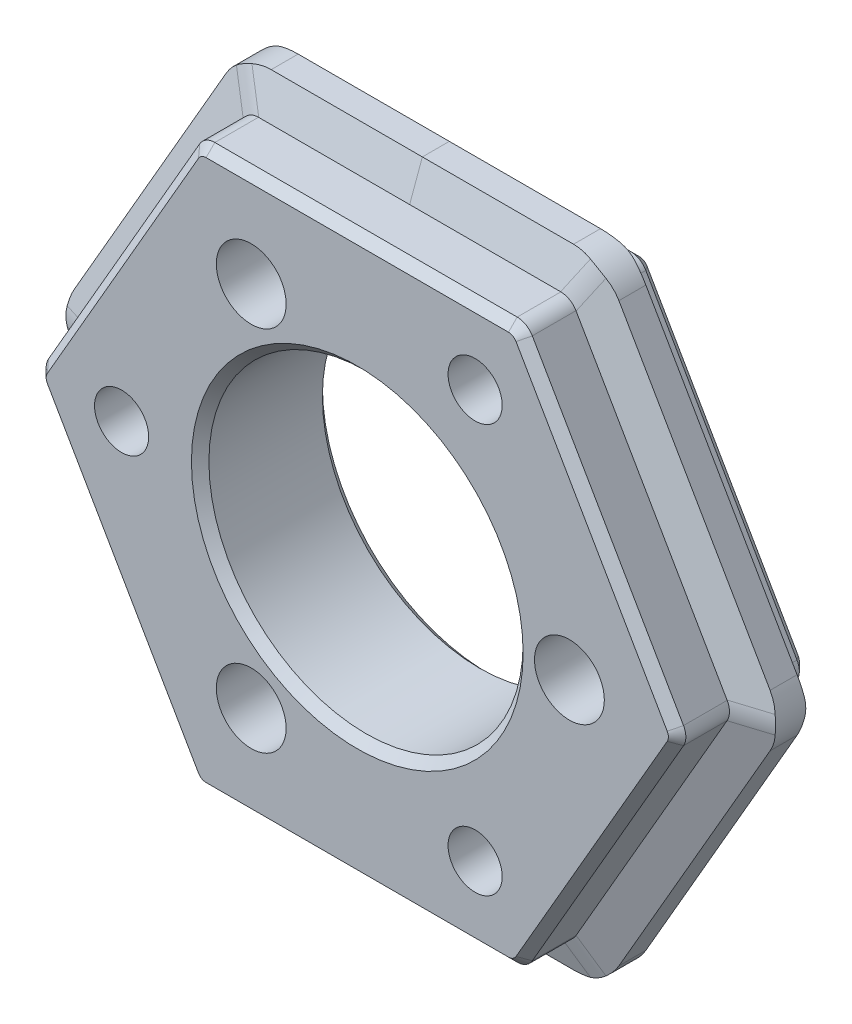
from build123d import *

# Parameters (mm, degrees)
EXTRUDE_1_DEPTH              = 3.75
HOLE_WIZARD_M3_1_D           = 3.1
HOLE_WIZARD_M3_1_CBORE_D     = 6
HOLE_WIZARD_M3_1_CBORE_DEPTH = 3.1
F_4_0MM_1_D                  = 4
F_4_0MM_1_DEPTH              = 3
F_4_0MM_1_TIP                = 1.2017212380551205
SKETCH_8_R                   = 9
CUT_EXTRUDE_1_DEPTH          = 26.565275929145265
FILLET_1_R                   = 3
FILLET_2_R                   = 1
CHAMFER_1_SIZE               = 0.5


with BuildPart() as part:
    # 草图2 → 凸台-拉伸1 (new, symmetric)
    with BuildSketch(Plane.XY):
        Polygon((9.237604307034019, 16.000000000000007), (-9.237604307034015, 16.000000000000007), (-18.475208614068023, -1.013e-14), (-9.237604307033997, -16.000000000000014), (9.237604307034022, -16.00000000000001), (18.475208614068038, 6.49e-15), align=None)
    extrude(amount=EXTRUDE_1_DEPTH, both=True)

    # M3 六角圆柱头螺钉的柱形沉头孔1 (through all)
    with Locations(Plane(origin=(0, 0, -3.75), x_dir=(-1, 0, 0), z_dir=(0, 0, -1))):
        with Locations((-6.75, 11.691342951), (13.5, 0), (-6.75, -11.691342951)):
            CounterBoreHole(HOLE_WIZARD_M3_1_D / 2, HOLE_WIZARD_M3_1_CBORE_D / 2, HOLE_WIZARD_M3_1_CBORE_DEPTH)

    # Ø4.0mm 暗销孔1
    with Locations(Plane.XY.offset(3.75)):
        with Locations((-6.075, 10.522208656), (12.15, 0), (-6.075, -10.522208656)):
            Hole(F_4_0MM_1_D / 2, depth=F_4_0MM_1_DEPTH)
            with Locations((0, 0, -(F_4_0MM_1_DEPTH + F_4_0MM_1_TIP / 2))):  # 118° drill point
                Cone(0, F_4_0MM_1_D / 2, F_4_0MM_1_TIP, mode=Mode.SUBTRACT)

    # 草图8 → 切除-拉伸1 (cut, through all)
    with BuildSketch(Plane.XY.offset(3.75)):
        Circle(SKETCH_8_R)
    extrude(amount=-CUT_EXTRUDE_1_DEPTH, mode=Mode.SUBTRACT)

    # 扫描1: sweep along a path in 草图10
    with BuildLine(Plane(origin=(0, 0, -0.7499999999999998), x_dir=(-1, 0, 0), z_dir=(0, 0, -1))) as sweep_1_path:
        Line((-9.237604307034019, 16.000000000000007), (-18.475208614068038, 6.49e-15))
        Line((-18.475208614068038, 6.49e-15), (-9.237604307034022, -16.00000000000001))
        Line((-9.237604307034022, -16.00000000000001), (9.237604307033997, -16.000000000000014))
        Line((9.237604307033997, -16.000000000000014), (18.475208614068023, -1.013e-14))
        Line((18.475208614068023, -1.013e-14), (9.237604307034015, 16.000000000000007))
        Line((9.237604307034015, 16.000000000000007), (-9.237604307034019, 16.000000000000007))
    # 草图11 → 扫描1 (sweep)
    with BuildSketch(Plane(origin=(0, 0, 0), x_dir=(0, 0, -1), z_dir=(1, 0, 0))):
        Polygon((-0.7500000000000007, 16.000000000000007), (-0.0220595314676011, 18.00000000000001), (1.5220595314676018, 18.00000000000001), (2.2499999999999996, 16.000000000000007), align=None)
    sweep(path=sweep_1_path.line, transition=Transition.RIGHT)

    # 圆角1
    # the kernel refuses this fillet: 3 mm, written as the material it takes off along each edge
    with BuildSketch(Plane(origin=(11.013072226794984, -19.075200644234634, -1.1307185011023613), x_dir=(0.8275631402450513, 0.5371571559215869, 0.16309947501442673), z_dir=(-0.47687096271147394, 0.825964736070557, -0.3006265784832193))) as fillet_1_piece_1_section:
        with BuildLine():
            CenterArc((FILLET_1_R * 0.173566836013, -FILLET_1_R), FILLET_1_R, 90.00000000000001, 19.693103879668)
            Line((-FILLET_1_R * 0.163415104569, -FILLET_1_R * 0.0584888892203), (0, 0))
            Line((0, 0), (FILLET_1_R * 0.173566836013, -3e-17))
        make_face()
    fillet_1_piece_1 = extrude(amount=5.024913422108485, mode=Mode.PRIVATE)
    fillet_1_piece_1 = split(fillet_1_piece_1, bisect_by=Plane(origin=(8.77785963865797, -16.79630112413624, -1.6514164671004177), z_dir=(0.8660254037844388, -0.4999999999999997, 0)), keep=Keep.TOP, mode=Mode.PRIVATE)
    fillet_1_piece_1 = split(fillet_1_piece_1, bisect_by=Plane(origin=(10.15709364378614, -16.00000000000001, -1.6514164671004177), z_dir=(1.9e-16, -1, 0)), keep=Keep.TOP, mode=Mode.PRIVATE)
    add(fillet_1_piece_1, mode=Mode.SUBTRACT)
    with BuildSketch(Plane(origin=(11.013072226794984, -19.075200644234634, -1.1307185011023613), x_dir=(0.8275631402450513, 0.5371571559215869, 0.16309947501442673), z_dir=(-0.47687096271147394, 0.825964736070557, -0.3006265784832193))) as fillet_1_piece_2_section:
        with BuildLine():
            CenterArc((FILLET_1_R * 0.173566836013, -FILLET_1_R), FILLET_1_R, 90.00000000000001, 19.693103879668)
            Line((-FILLET_1_R * 0.163415104569, -FILLET_1_R * 0.0584888892203), (0, 0))
            Line((0, 0), (FILLET_1_R * 0.173566836013, -3e-17))
        make_face()
    fillet_1_piece_2 = extrude(amount=5.024913422108485, mode=Mode.PRIVATE)
    fillet_1_piece_2 = split(fillet_1_piece_2, bisect_by=Plane(origin=(9.094560258170244, -16.24775956035244, -2.217523838552889), z_dir=(-0.8660254037844388, 0.4999999999999997, 0)), keep=Keep.TOP, mode=Mode.PRIVATE)
    fillet_1_piece_2 = split(fillet_1_piece_2, bisect_by=Plane(origin=(8.951516209167089, -16.00000000000001, -2.217523838552889), z_dir=(1.9e-16, -1, 0)), keep=Keep.TOP, mode=Mode.PRIVATE)
    add(fillet_1_piece_2, mode=Mode.SUBTRACT)
    with BuildSketch(Plane(origin=(11.013072226794984, -19.075200644234634, -1.1307185011023613), x_dir=(0.8275631402450513, 0.5371571559215869, 0.16309947501442673), z_dir=(-0.47687096271147394, 0.825964736070557, -0.3006265784832193))) as fillet_1_piece_3_section:
        with BuildLine():
            CenterArc((FILLET_1_R * 0.173566836013, -FILLET_1_R), FILLET_1_R, 90.00000000000001, 19.693103879668)
            Line((-FILLET_1_R * 0.163415104569, -FILLET_1_R * 0.0584888892203), (0, 0))
            Line((0, 0), (FILLET_1_R * 0.173566836013, -3e-17))
        make_face()
    fillet_1_piece_3 = extrude(amount=5.024913422108485, mode=Mode.PRIVATE)
    fillet_1_piece_3 = split(fillet_1_piece_3, bisect_by=Plane(origin=(9.380648355967478, -15.752240439526894, -2.2175238385528853), z_dir=(0.8660254037844388, -0.4999999999999997, 0)), keep=Keep.TOP, mode=Mode.PRIVATE)
    fillet_1_piece_3 = split(fillet_1_piece_3, bisect_by=Plane(origin=(9.523692404761562, -16.00000000000001, -2.2175238385528853), z_dir=(-1.9e-16, 1, 0)), keep=Keep.TOP, mode=Mode.PRIVATE)
    add(fillet_1_piece_3, mode=Mode.SUBTRACT)
    with BuildSketch(Plane(origin=(8.6168369256523, -14.924799355765396, 1.141341030365242), x_dir=(0.827563140245051, 0.5371571559215874, -0.16309947501442654), z_dir=(0.4768709627114744, -0.8259647360705566, -0.3006265784832199))) as fillet_1_piece_4_section:
        with BuildLine():
            CenterArc((FILLET_1_R * 0.173566836013, -FILLET_1_R), FILLET_1_R, 90, 19.693103879668)
            Line((-FILLET_1_R * 0.163415104569, -FILLET_1_R * 0.0584888892203), (0, 0))
            Line((0, 0), (FILLET_1_R * 0.173566836013, -1e-17))
        make_face()
    fillet_1_piece_4 = extrude(amount=5.024913422108494, mode=Mode.PRIVATE)
    fillet_1_piece_4 = split(fillet_1_piece_4, bisect_by=Plane(origin=(9.094560258170246, -16.24775956035244, 0.717523838552887), z_dir=(-0.8660254037844388, 0.4999999999999997, 0)), keep=Keep.TOP, mode=Mode.PRIVATE)
    fillet_1_piece_4 = split(fillet_1_piece_4, bisect_by=Plane(origin=(8.9515162091671, -16.00000000000001, 0.717523838552887), z_dir=(1.9e-16, -1, 0)), keep=Keep.TOP, mode=Mode.PRIVATE)
    add(fillet_1_piece_4, mode=Mode.SUBTRACT)
    with BuildSketch(Plane(origin=(8.6168369256523, -14.924799355765396, 1.141341030365242), x_dir=(0.827563140245051, 0.5371571559215874, -0.16309947501442654), z_dir=(0.4768709627114744, -0.8259647360705566, -0.3006265784832199))) as fillet_1_piece_5_section:
        with BuildLine():
            CenterArc((FILLET_1_R * 0.173566836013, -FILLET_1_R), FILLET_1_R, 90, 19.693103879668)
            Line((-FILLET_1_R * 0.163415104569, -FILLET_1_R * 0.0584888892203), (0, 0))
            Line((0, 0), (FILLET_1_R * 0.173566836013, -1e-17))
        make_face()
    fillet_1_piece_5 = extrude(amount=5.024913422108494, mode=Mode.PRIVATE)
    fillet_1_piece_5 = split(fillet_1_piece_5, bisect_by=Plane(origin=(9.380648355967482, -15.75224043952689, 0.7175238385528858), z_dir=(0.8660254037844388, -0.4999999999999997, 0)), keep=Keep.TOP, mode=Mode.PRIVATE)
    fillet_1_piece_5 = split(fillet_1_piece_5, bisect_by=Plane(origin=(9.523692404761569, -16.00000000000001, 0.7175238385528858), z_dir=(-1.9e-16, 1, 0)), keep=Keep.TOP, mode=Mode.PRIVATE)
    add(fillet_1_piece_5, mode=Mode.SUBTRACT)
    with BuildSketch(Plane(origin=(8.6168369256523, -14.924799355765396, 1.141341030365242), x_dir=(0.827563140245051, 0.5371571559215874, -0.16309947501442654), z_dir=(0.4768709627114744, -0.8259647360705566, -0.3006265784832199))) as fillet_1_piece_6_section:
        with BuildLine():
            CenterArc((FILLET_1_R * 0.173566836013, -FILLET_1_R), FILLET_1_R, 90, 19.693103879668)
            Line((-FILLET_1_R * 0.163415104569, -FILLET_1_R * 0.0584888892203), (0, 0))
            Line((0, 0), (FILLET_1_R * 0.173566836013, -1e-17))
        make_face()
    fillet_1_piece_6 = extrude(amount=5.024913422108494, mode=Mode.PRIVATE)
    fillet_1_piece_6 = split(fillet_1_piece_6, bisect_by=Plane(origin=(8.777859638657972, -16.796301124136235, 0.1514164671004277), z_dir=(0.8660254037844388, -0.4999999999999997, 0)), keep=Keep.TOP, mode=Mode.PRIVATE)
    fillet_1_piece_6 = split(fillet_1_piece_6, bisect_by=Plane(origin=(10.15709364378612, -16.00000000000001, 0.1514164671004277), z_dir=(1.9e-16, -1, 0)), keep=Keep.TOP, mode=Mode.PRIVATE)
    add(fillet_1_piece_6, mode=Mode.SUBTRACT)
    with BuildSketch(Plane(origin=(10.392304845413273, -18.000000000000014, 4.352186550389803), x_dir=(0.4999999999999995, 0.8660254037844389, 0), z_dir=(1.3e-16, 1e-17, -1))) as fillet_1_piece_7:
        with BuildLine():
            CenterArc((FILLET_1_R * 0.57735026919, -FILLET_1_R), FILLET_1_R, 90.00000000000004, 59.99999999999996)
            Line((-FILLET_1_R * 0.288675134595, -FILLET_1_R * 0.5), (0, 0))
            Line((0, 0), (FILLET_1_R * 0.57735026919, -3e-17))
        make_face()
    extrude(amount=10.204373100779605, mode=Mode.SUBTRACT)
    with BuildSketch(Plane(origin=(22.026144453589964, -3.55e-15, -1.1307185011023626), x_dir=(-0.0514101727301685, 0.9852692806486315, 0.1630994750144295), z_dir=(-0.9537419254229484, 0, -0.30062657848321933))) as fillet_1_piece_8_section:
        with BuildLine():
            CenterArc((FILLET_1_R * 0.173566836013, -FILLET_1_R), FILLET_1_R, 90.00000000000018, 19.693103879667916)
            Line((-FILLET_1_R * 0.163415104569, -FILLET_1_R * 0.0584888892203), (0, 0))
            Line((0, 0), (FILLET_1_R * 0.173566836013, 1e-17))
        make_face()
    fillet_1_piece_8 = extrude(amount=5.024913422108481, mode=Mode.PRIVATE)
    fillet_1_piece_8 = split(fillet_1_piece_8, bisect_by=Plane(origin=(18.934953282444074, -0.7963011241361938, -1.6514164671004352), z_dir=(0.8660254037844385, 0.5000000000000003, 0)), keep=Keep.TOP, mode=Mode.PRIVATE)
    fillet_1_piece_8 = split(fillet_1_piece_8, bisect_by=Plane(origin=(18.934953282444077, 0.7963011241362139, -1.6514164671004352), z_dir=(0.8660254037844388, -0.4999999999999997, 0)), keep=Keep.TOP, mode=Mode.PRIVATE)
    add(fillet_1_piece_8, mode=Mode.SUBTRACT)
    with BuildSketch(Plane(origin=(22.026144453589964, -3.55e-15, -1.1307185011023626), x_dir=(-0.0514101727301685, 0.9852692806486315, 0.1630994750144295), z_dir=(-0.9537419254229484, 0, -0.30062657848321933))) as fillet_1_piece_9_section:
        with BuildLine():
            CenterArc((FILLET_1_R * 0.173566836013, -FILLET_1_R), FILLET_1_R, 90.00000000000018, 19.693103879667916)
            Line((-FILLET_1_R * 0.163415104569, -FILLET_1_R * 0.0584888892203), (0, 0))
            Line((0, 0), (FILLET_1_R * 0.173566836013, 1e-17))
        make_face()
    fillet_1_piece_9 = extrude(amount=5.024913422108481, mode=Mode.PRIVATE)
    fillet_1_piece_9 = split(fillet_1_piece_9, bisect_by=Plane(origin=(18.618252662931816, -0.24775956035241992, -2.2175238385528835), z_dir=(-0.8660254037844385, -0.5000000000000003, 0)), keep=Keep.TOP, mode=Mode.PRIVATE)
    fillet_1_piece_9 = split(fillet_1_piece_9, bisect_by=Plane(origin=(18.332164565134576, -0.24775956047312064, -2.2175238385528835), z_dir=(0.8660254037844388, -0.4999999999999997, 0)), keep=Keep.TOP, mode=Mode.PRIVATE)
    add(fillet_1_piece_9, mode=Mode.SUBTRACT)
    with BuildSketch(Plane(origin=(22.026144453589964, -3.55e-15, -1.1307185011023626), x_dir=(-0.0514101727301685, 0.9852692806486315, 0.1630994750144295), z_dir=(-0.9537419254229484, 0, -0.30062657848321933))) as fillet_1_piece_10_section:
        with BuildLine():
            CenterArc((FILLET_1_R * 0.173566836013, -FILLET_1_R), FILLET_1_R, 90.00000000000018, 19.693103879667916)
            Line((-FILLET_1_R * 0.163415104569, -FILLET_1_R * 0.0584888892203), (0, 0))
            Line((0, 0), (FILLET_1_R * 0.173566836013, 1e-17))
        make_face()
    fillet_1_piece_10 = extrude(amount=5.024913422108481, mode=Mode.PRIVATE)
    fillet_1_piece_10 = split(fillet_1_piece_10, bisect_by=Plane(origin=(18.332164565134587, 0.2477595604731119, -2.21752383855288), z_dir=(0.8660254037844385, 0.5000000000000003, 0)), keep=Keep.TOP, mode=Mode.PRIVATE)
    fillet_1_piece_10 = split(fillet_1_piece_10, bisect_by=Plane(origin=(18.618252662931802, 0.24775956035241364, -2.21752383855288), z_dir=(-0.8660254037844388, 0.4999999999999997, 0)), keep=Keep.TOP, mode=Mode.PRIVATE)
    add(fillet_1_piece_10, mode=Mode.SUBTRACT)
    with BuildSketch(Plane(origin=(17.233673851304623, -7.11e-15, 1.1413410303652356), x_dir=(-0.051410172730167375, 0.9852692806486322, -0.16309947501442565), z_dir=(0.9537419254229482, 0, -0.30062657848321983))) as fillet_1_piece_11_section:
        with BuildLine():
            CenterArc((FILLET_1_R * 0.173566836013, -FILLET_1_R), FILLET_1_R, 89.99999999999994, 19.693103879667973)
            Line((-FILLET_1_R * 0.163415104569, -FILLET_1_R * 0.0584888892203), (0, 0))
            Line((0, 0), (FILLET_1_R * 0.173566836013, 0))
        make_face()
    fillet_1_piece_11 = extrude(amount=5.024913422108468, mode=Mode.PRIVATE)
    fillet_1_piece_11 = split(fillet_1_piece_11, bisect_by=Plane(origin=(18.61825266293182, -0.24775956035242916, 0.7175238385528852), z_dir=(-0.8660254037844385, -0.5000000000000003, 0)), keep=Keep.TOP, mode=Mode.PRIVATE)
    fillet_1_piece_11 = split(fillet_1_piece_11, bisect_by=Plane(origin=(18.332164565134576, -0.24775956047311354, 0.7175238385528852), z_dir=(0.8660254037844388, -0.4999999999999997, 0)), keep=Keep.TOP, mode=Mode.PRIVATE)
    add(fillet_1_piece_11, mode=Mode.SUBTRACT)
    with BuildSketch(Plane(origin=(17.233673851304623, -7.11e-15, 1.1413410303652356), x_dir=(-0.051410172730167375, 0.9852692806486322, -0.16309947501442565), z_dir=(0.9537419254229482, 0, -0.30062657848321983))) as fillet_1_piece_12_section:
        with BuildLine():
            CenterArc((FILLET_1_R * 0.173566836013, -FILLET_1_R), FILLET_1_R, 89.99999999999994, 19.693103879667973)
            Line((-FILLET_1_R * 0.163415104569, -FILLET_1_R * 0.0584888892203), (0, 0))
            Line((0, 0), (FILLET_1_R * 0.173566836013, 0))
        make_face()
    fillet_1_piece_12 = extrude(amount=5.024913422108468, mode=Mode.PRIVATE)
    fillet_1_piece_12 = split(fillet_1_piece_12, bisect_by=Plane(origin=(18.332164565134583, 0.24775956047311498, 0.7175238385528835), z_dir=(0.8660254037844385, 0.5000000000000003, 0)), keep=Keep.TOP, mode=Mode.PRIVATE)
    fillet_1_piece_12 = split(fillet_1_piece_12, bisect_by=Plane(origin=(18.618252662931802, 0.24775956035241364, 0.7175238385528835), z_dir=(-0.8660254037844388, 0.4999999999999997, 0)), keep=Keep.TOP, mode=Mode.PRIVATE)
    add(fillet_1_piece_12, mode=Mode.SUBTRACT)
    with BuildSketch(Plane(origin=(17.233673851304623, -7.11e-15, 1.1413410303652356), x_dir=(-0.051410172730167375, 0.9852692806486322, -0.16309947501442565), z_dir=(0.9537419254229482, 0, -0.30062657848321983))) as fillet_1_piece_13_section:
        with BuildLine():
            CenterArc((FILLET_1_R * 0.173566836013, -FILLET_1_R), FILLET_1_R, 89.99999999999994, 19.693103879667973)
            Line((-FILLET_1_R * 0.163415104569, -FILLET_1_R * 0.0584888892203), (0, 0))
            Line((0, 0), (FILLET_1_R * 0.173566836013, 0))
        make_face()
    fillet_1_piece_13 = extrude(amount=5.024913422108468, mode=Mode.PRIVATE)
    fillet_1_piece_13 = split(fillet_1_piece_13, bisect_by=Plane(origin=(18.934953282444074, -0.7963011241361907, 0.15141646710044432), z_dir=(0.8660254037844385, 0.5000000000000003, 0)), keep=Keep.TOP, mode=Mode.PRIVATE)
    fillet_1_piece_13 = split(fillet_1_piece_13, bisect_by=Plane(origin=(18.93495328244407, 0.7963011241361961, 0.15141646710044432), z_dir=(0.8660254037844388, -0.4999999999999997, 0)), keep=Keep.TOP, mode=Mode.PRIVATE)
    add(fillet_1_piece_13, mode=Mode.SUBTRACT)
    with BuildSketch(Plane(origin=(20.78460969082654, -3.55e-15, 4.352186550389796), x_dir=(-0.5000000000000008, 0.8660254037844382, 0), z_dir=(1.3e-16, 0, -1))) as fillet_1_piece_14:
        with BuildLine():
            CenterArc((FILLET_1_R * 0.57735026919, -FILLET_1_R), FILLET_1_R, 90.00000000000006, 59.999999999999886)
            Line((-FILLET_1_R * 0.288675134595, -FILLET_1_R * 0.5), (0, 0))
            Line((0, 0), (FILLET_1_R * 0.57735026919, 6e-17))
        make_face()
    extrude(amount=10.204373100779591, mode=Mode.SUBTRACT)
    with BuildSketch(Plane(origin=(-11.013072226794968, -19.075200644234634, -1.13071850110236), x_dir=(-0.8275631402450518, 0.5371571559215866, 0.1630994750144258), z_dir=(0.4768709627114737, 0.8259647360705572, -0.3006265784832193))) as fillet_1_piece_15_section:
        with BuildLine():
            CenterArc((FILLET_1_R * 0.173566836013, FILLET_1_R), FILLET_1_R, 250.30689612033214, 19.693103879667888)
            Line((-FILLET_1_R * 0.163415104569, FILLET_1_R * 0.0584888892203), (0, 0))
            Line((0, 0), (FILLET_1_R * 0.173566836013, -1e-17))
        make_face()
    fillet_1_piece_15 = extrude(amount=5.024913422108492, mode=Mode.PRIVATE)
    fillet_1_piece_15 = split(fillet_1_piece_15, bisect_by=Plane(origin=(-8.777859638657937, -16.796301124136257, -1.651416467100414), z_dir=(-0.8660254037844384, -0.5000000000000004, 0)), keep=Keep.TOP, mode=Mode.PRIVATE)
    fillet_1_piece_15 = split(fillet_1_piece_15, bisect_by=Plane(origin=(-10.157093643786112, -16.000000000000014, -1.651416467100414), z_dir=(1.9e-16, -1, 0)), keep=Keep.TOP, mode=Mode.PRIVATE)
    add(fillet_1_piece_15, mode=Mode.SUBTRACT)
    with BuildSketch(Plane(origin=(-11.013072226794968, -19.075200644234634, -1.13071850110236), x_dir=(-0.8275631402450518, 0.5371571559215866, 0.1630994750144258), z_dir=(0.4768709627114737, 0.8259647360705572, -0.3006265784832193))) as fillet_1_piece_16_section:
        with BuildLine():
            CenterArc((FILLET_1_R * 0.173566836013, FILLET_1_R), FILLET_1_R, 250.30689612033214, 19.693103879667888)
            Line((-FILLET_1_R * 0.163415104569, FILLET_1_R * 0.0584888892203), (0, 0))
            Line((0, 0), (FILLET_1_R * 0.173566836013, -1e-17))
        make_face()
    fillet_1_piece_16 = extrude(amount=5.024913422108492, mode=Mode.PRIVATE)
    fillet_1_piece_16 = split(fillet_1_piece_16, bisect_by=Plane(origin=(-9.094560258170224, -16.247759560352435, -2.2175238385528835), z_dir=(0.8660254037844384, 0.5000000000000004, 0)), keep=Keep.TOP, mode=Mode.PRIVATE)
    fillet_1_piece_16 = split(fillet_1_piece_16, bisect_by=Plane(origin=(-8.951516209167078, -16.000000000000014, -2.2175238385528835), z_dir=(1.9e-16, -1, 0)), keep=Keep.TOP, mode=Mode.PRIVATE)
    add(fillet_1_piece_16, mode=Mode.SUBTRACT)
    with BuildSketch(Plane(origin=(-11.013072226794968, -19.075200644234634, -1.13071850110236), x_dir=(-0.8275631402450518, 0.5371571559215866, 0.1630994750144258), z_dir=(0.4768709627114737, 0.8259647360705572, -0.3006265784832193))) as fillet_1_piece_17_section:
        with BuildLine():
            CenterArc((FILLET_1_R * 0.173566836013, FILLET_1_R), FILLET_1_R, 250.30689612033214, 19.693103879667888)
            Line((-FILLET_1_R * 0.163415104569, FILLET_1_R * 0.0584888892203), (0, 0))
            Line((0, 0), (FILLET_1_R * 0.173566836013, -1e-17))
        make_face()
    fillet_1_piece_17 = extrude(amount=5.024913422108492, mode=Mode.PRIVATE)
    fillet_1_piece_17 = split(fillet_1_piece_17, bisect_by=Plane(origin=(-9.380648355967464, -15.752240439526881, -2.21752383855289), z_dir=(-0.8660254037844384, -0.5000000000000004, 0)), keep=Keep.TOP, mode=Mode.PRIVATE)
    fillet_1_piece_17 = split(fillet_1_piece_17, bisect_by=Plane(origin=(-9.523692404761556, -16.000000000000014, -2.21752383855289), z_dir=(-1.9e-16, 1, 0)), keep=Keep.TOP, mode=Mode.PRIVATE)
    add(fillet_1_piece_17, mode=Mode.SUBTRACT)
    with BuildSketch(Plane(origin=(-8.616836925652288, -14.924799355765401, 1.14134103036524), x_dir=(-0.8275631402450507, 0.5371571559215874, -0.16309947501442776), z_dir=(-0.47687096271147417, -0.8259647360705566, -0.3006265784832199))) as fillet_1_piece_18_section:
        with BuildLine():
            CenterArc((FILLET_1_R * 0.173566836013, FILLET_1_R), FILLET_1_R, 250.30689612033197, 19.693103879667945)
            Line((-FILLET_1_R * 0.163415104569, FILLET_1_R * 0.0584888892203), (0, 0))
            Line((0, 0), (FILLET_1_R * 0.173566836013, -1e-17))
        make_face()
    fillet_1_piece_18 = extrude(amount=5.024913422108481, mode=Mode.PRIVATE)
    fillet_1_piece_18 = split(fillet_1_piece_18, bisect_by=Plane(origin=(-9.094560258170242, -16.247759560352403, 0.7175238385528596), z_dir=(0.8660254037844384, 0.5000000000000004, 0)), keep=Keep.TOP, mode=Mode.PRIVATE)
    fillet_1_piece_18 = split(fillet_1_piece_18, bisect_by=Plane(origin=(-8.95151620916711, -16.000000000000014, 0.7175238385528596), z_dir=(1.9e-16, -1, 0)), keep=Keep.TOP, mode=Mode.PRIVATE)
    add(fillet_1_piece_18, mode=Mode.SUBTRACT)
    with BuildSketch(Plane(origin=(-8.616836925652288, -14.924799355765401, 1.14134103036524), x_dir=(-0.8275631402450507, 0.5371571559215874, -0.16309947501442776), z_dir=(-0.47687096271147417, -0.8259647360705566, -0.3006265784832199))) as fillet_1_piece_19_section:
        with BuildLine():
            CenterArc((FILLET_1_R * 0.173566836013, FILLET_1_R), FILLET_1_R, 250.30689612033197, 19.693103879667945)
            Line((-FILLET_1_R * 0.163415104569, FILLET_1_R * 0.0584888892203), (0, 0))
            Line((0, 0), (FILLET_1_R * 0.173566836013, -1e-17))
        make_face()
    fillet_1_piece_19 = extrude(amount=5.024913422108481, mode=Mode.PRIVATE)
    fillet_1_piece_19 = split(fillet_1_piece_19, bisect_by=Plane(origin=(-9.38064835596746, -15.752240439526886, 0.7175238385528897), z_dir=(-0.8660254037844384, -0.5000000000000004, 0)), keep=Keep.TOP, mode=Mode.PRIVATE)
    fillet_1_piece_19 = split(fillet_1_piece_19, bisect_by=Plane(origin=(-9.523692404761556, -16.000000000000014, 0.7175238385528897), z_dir=(-1.9e-16, 1, 0)), keep=Keep.TOP, mode=Mode.PRIVATE)
    add(fillet_1_piece_19, mode=Mode.SUBTRACT)
    with BuildSketch(Plane(origin=(-8.616836925652288, -14.924799355765401, 1.14134103036524), x_dir=(-0.8275631402450507, 0.5371571559215874, -0.16309947501442776), z_dir=(-0.47687096271147417, -0.8259647360705566, -0.3006265784832199))) as fillet_1_piece_20_section:
        with BuildLine():
            CenterArc((FILLET_1_R * 0.173566836013, FILLET_1_R), FILLET_1_R, 250.30689612033197, 19.693103879667945)
            Line((-FILLET_1_R * 0.163415104569, FILLET_1_R * 0.0584888892203), (0, 0))
            Line((0, 0), (FILLET_1_R * 0.173566836013, -1e-17))
        make_face()
    fillet_1_piece_20 = extrude(amount=5.024913422108481, mode=Mode.PRIVATE)
    fillet_1_piece_20 = split(fillet_1_piece_20, bisect_by=Plane(origin=(-8.777859638657965, -16.796301124136207, 0.15141646710045148), z_dir=(-0.8660254037844384, -0.5000000000000004, 0)), keep=Keep.TOP, mode=Mode.PRIVATE)
    fillet_1_piece_20 = split(fillet_1_piece_20, bisect_by=Plane(origin=(-10.157093643786018, -16.000000000000014, 0.15141646710045148), z_dir=(1.9e-16, -1, 0)), keep=Keep.TOP, mode=Mode.PRIVATE)
    add(fillet_1_piece_20, mode=Mode.SUBTRACT)
    with BuildSketch(Plane(origin=(-10.392304845413253, -18.000000000000014, 4.352186550389792), x_dir=(-0.5000000000000002, 0.8660254037844385, 0), z_dir=(-1.3e-16, 1e-17, -1))) as fillet_1_piece_21:
        with BuildLine():
            CenterArc((FILLET_1_R * 0.57735026919, FILLET_1_R), FILLET_1_R, 210.00000000000003, 59.99999999999994)
            Line((-FILLET_1_R * 0.288675134595, FILLET_1_R * 0.5), (0, 0))
            Line((0, 0), (FILLET_1_R * 0.57735026919, -1.1e-16))
        make_face()
    extrude(amount=10.204373100779584, mode=Mode.SUBTRACT)
    with BuildSketch(Plane(origin=(10.392304845413275, 18.00000000000001, 4.352186550389797), x_dir=(-1, 0, -1.3e-16), z_dir=(1.3e-16, 0, -1))) as fillet_1_piece_22:
        with BuildLine():
            CenterArc((FILLET_1_R * 0.57735026919, -FILLET_1_R), FILLET_1_R, 90, 60)
            Line((-FILLET_1_R * 0.288675134595, -FILLET_1_R * 0.5), (0, 0))
            Line((0, 0), (FILLET_1_R * 0.57735026919, 0))
        make_face()
    extrude(amount=10.204373100779595, mode=Mode.SUBTRACT)
    with BuildSketch(Plane(origin=(8.6168369256523, 14.924799355765387, 1.1413410303652434), x_dir=(-0.8789733129752185, 0.44811212472704515, -0.16309947501442698), z_dir=(0.4768709627114746, 0.8259647360705565, -0.30062657848321983))) as fillet_1_piece_23_section:
        with BuildLine():
            CenterArc((FILLET_1_R * 0.173566836013, -FILLET_1_R), FILLET_1_R, 90, 19.69310387966803)
            Line((-FILLET_1_R * 0.163415104569, -FILLET_1_R * 0.0584888892203), (0, 0))
            Line((0, 0), (FILLET_1_R * 0.173566836013, -1e-17))
        make_face()
    fillet_1_piece_23 = extrude(amount=5.024913422108499, mode=Mode.PRIVATE)
    fillet_1_piece_23 = split(fillet_1_piece_23, bisect_by=Plane(origin=(9.523692404761576, 16.000000000000007, 0.7175238385528888), z_dir=(0, -1, 0)), keep=Keep.TOP, mode=Mode.PRIVATE)
    fillet_1_piece_23 = split(fillet_1_piece_23, bisect_by=Plane(origin=(9.380648355967482, 15.75224043952688, 0.7175238385528888), z_dir=(0.8660254037844385, 0.5000000000000003, 0)), keep=Keep.TOP, mode=Mode.PRIVATE)
    add(fillet_1_piece_23, mode=Mode.SUBTRACT)
    with BuildSketch(Plane(origin=(8.6168369256523, 14.924799355765387, 1.1413410303652434), x_dir=(-0.8789733129752185, 0.44811212472704515, -0.16309947501442698), z_dir=(0.4768709627114746, 0.8259647360705565, -0.30062657848321983))) as fillet_1_piece_24_section:
        with BuildLine():
            CenterArc((FILLET_1_R * 0.173566836013, -FILLET_1_R), FILLET_1_R, 90, 19.69310387966803)
            Line((-FILLET_1_R * 0.163415104569, -FILLET_1_R * 0.0584888892203), (0, 0))
            Line((0, 0), (FILLET_1_R * 0.173566836013, -1e-17))
        make_face()
    fillet_1_piece_24 = extrude(amount=5.024913422108499, mode=Mode.PRIVATE)
    fillet_1_piece_24 = split(fillet_1_piece_24, bisect_by=Plane(origin=(8.951516209167092, 16.000000000000007, 0.7175238385528887), z_dir=(0, 1, 0)), keep=Keep.TOP, mode=Mode.PRIVATE)
    fillet_1_piece_24 = split(fillet_1_piece_24, bisect_by=Plane(origin=(9.094560258170237, 16.24775956035244, 0.7175238385528887), z_dir=(-0.8660254037844385, -0.5000000000000003, 0)), keep=Keep.TOP, mode=Mode.PRIVATE)
    add(fillet_1_piece_24, mode=Mode.SUBTRACT)
    with BuildSketch(Plane(origin=(8.6168369256523, 14.924799355765387, 1.1413410303652434), x_dir=(-0.8789733129752185, 0.44811212472704515, -0.16309947501442698), z_dir=(0.4768709627114746, 0.8259647360705565, -0.30062657848321983))) as fillet_1_piece_25_section:
        with BuildLine():
            CenterArc((FILLET_1_R * 0.173566836013, -FILLET_1_R), FILLET_1_R, 90, 19.69310387966803)
            Line((-FILLET_1_R * 0.163415104569, -FILLET_1_R * 0.0584888892203), (0, 0))
            Line((0, 0), (FILLET_1_R * 0.173566836013, -1e-17))
        make_face()
    fillet_1_piece_25 = extrude(amount=5.024913422108499, mode=Mode.PRIVATE)
    fillet_1_piece_25 = split(fillet_1_piece_25, bisect_by=Plane(origin=(10.157093643786142, 16.000000000000007, 0.1514164671004098), z_dir=(0, 1, 0)), keep=Keep.TOP, mode=Mode.PRIVATE)
    fillet_1_piece_25 = split(fillet_1_piece_25, bisect_by=Plane(origin=(8.77785963865795, 16.796301124136257, 0.1514164671004098), z_dir=(0.8660254037844385, 0.5000000000000003, 0)), keep=Keep.TOP, mode=Mode.PRIVATE)
    add(fillet_1_piece_25, mode=Mode.SUBTRACT)
    with BuildSketch(Plane(origin=(11.013072226794993, 19.075200644234634, -1.130718501102359), x_dir=(-0.8789733129752187, 0.4481121247270445, 0.1630994750144276), z_dir=(-0.47687096271147417, -0.8259647360705569, -0.3006265784832192))) as fillet_1_piece_26_section:
        with BuildLine():
            CenterArc((FILLET_1_R * 0.173566836013, -FILLET_1_R), FILLET_1_R, 90.00000000000006, 19.69310387966793)
            Line((-FILLET_1_R * 0.163415104569, -FILLET_1_R * 0.0584888892203), (0, 0))
            Line((0, 0), (FILLET_1_R * 0.173566836013, 0))
        make_face()
    fillet_1_piece_26 = extrude(amount=5.0249134221085, mode=Mode.PRIVATE)
    fillet_1_piece_26 = split(fillet_1_piece_26, bisect_by=Plane(origin=(10.15709364378614, 16.000000000000007, -1.6514164671004123), z_dir=(0, 1, 0)), keep=Keep.TOP, mode=Mode.PRIVATE)
    fillet_1_piece_26 = split(fillet_1_piece_26, bisect_by=Plane(origin=(8.777859638657954, 16.79630112413625, -1.6514164671004123), z_dir=(0.8660254037844385, 0.5000000000000003, 0)), keep=Keep.TOP, mode=Mode.PRIVATE)
    add(fillet_1_piece_26, mode=Mode.SUBTRACT)
    with BuildSketch(Plane(origin=(11.013072226794993, 19.075200644234634, -1.130718501102359), x_dir=(-0.8789733129752187, 0.4481121247270445, 0.1630994750144276), z_dir=(-0.47687096271147417, -0.8259647360705569, -0.3006265784832192))) as fillet_1_piece_27_section:
        with BuildLine():
            CenterArc((FILLET_1_R * 0.173566836013, -FILLET_1_R), FILLET_1_R, 90.00000000000006, 19.69310387966793)
            Line((-FILLET_1_R * 0.163415104569, -FILLET_1_R * 0.0584888892203), (0, 0))
            Line((0, 0), (FILLET_1_R * 0.173566836013, 0))
        make_face()
    fillet_1_piece_27 = extrude(amount=5.0249134221085, mode=Mode.PRIVATE)
    fillet_1_piece_27 = split(fillet_1_piece_27, bisect_by=Plane(origin=(9.523692404761562, 16.000000000000007, -2.217523838552889), z_dir=(0, -1, 0)), keep=Keep.TOP, mode=Mode.PRIVATE)
    fillet_1_piece_27 = split(fillet_1_piece_27, bisect_by=Plane(origin=(9.380648355967478, 15.752240439526885, -2.217523838552889), z_dir=(0.8660254037844385, 0.5000000000000003, 0)), keep=Keep.TOP, mode=Mode.PRIVATE)
    add(fillet_1_piece_27, mode=Mode.SUBTRACT)
    with BuildSketch(Plane(origin=(11.013072226794993, 19.075200644234634, -1.130718501102359), x_dir=(-0.8789733129752187, 0.4481121247270445, 0.1630994750144276), z_dir=(-0.47687096271147417, -0.8259647360705569, -0.3006265784832192))) as fillet_1_piece_28_section:
        with BuildLine():
            CenterArc((FILLET_1_R * 0.173566836013, -FILLET_1_R), FILLET_1_R, 90.00000000000006, 19.69310387966793)
            Line((-FILLET_1_R * 0.163415104569, -FILLET_1_R * 0.0584888892203), (0, 0))
            Line((0, 0), (FILLET_1_R * 0.173566836013, 0))
        make_face()
    fillet_1_piece_28 = extrude(amount=5.0249134221085, mode=Mode.PRIVATE)
    fillet_1_piece_28 = split(fillet_1_piece_28, bisect_by=Plane(origin=(8.951516209167094, 16.000000000000007, -2.217523838552887), z_dir=(0, 1, 0)), keep=Keep.TOP, mode=Mode.PRIVATE)
    fillet_1_piece_28 = split(fillet_1_piece_28, bisect_by=Plane(origin=(9.09456025817024, 16.24775956035243, -2.217523838552887), z_dir=(-0.8660254037844385, -0.5000000000000003, 0)), keep=Keep.TOP, mode=Mode.PRIVATE)
    add(fillet_1_piece_28, mode=Mode.SUBTRACT)
    with BuildSketch(Plane(origin=(-22.026144453589954, -1.255e-14, -1.1307185011023635), x_dir=(0.05141017273016751, 0.9852692806486318, 0.1630994750144275), z_dir=(0.9537419254229484, 0, -0.3006265784832193))) as fillet_1_piece_29_section:
        with BuildLine():
            CenterArc((FILLET_1_R * 0.173566836013, FILLET_1_R), FILLET_1_R, 250.30689612033197, 19.693103879668)
            Line((-FILLET_1_R * 0.163415104569, FILLET_1_R * 0.0584888892203), (0, 0))
            Line((0, 0), (FILLET_1_R * 0.173566836013, 1e-17))
        make_face()
    fillet_1_piece_29 = extrude(amount=5.024913422108485, mode=Mode.PRIVATE)
    fillet_1_piece_29 = split(fillet_1_piece_29, bisect_by=Plane(origin=(-18.934953282444, -0.7963011241361109, -1.6514164671005362), z_dir=(-0.866025403784439, 0.49999999999999944, 0)), keep=Keep.TOP, mode=Mode.PRIVATE)
    fillet_1_piece_29 = split(fillet_1_piece_29, bisect_by=Plane(origin=(-18.93495328244394, 0.7963011241359793, -1.6514164671005362), z_dir=(-0.8660254037844384, -0.5000000000000004, 0)), keep=Keep.TOP, mode=Mode.PRIVATE)
    add(fillet_1_piece_29, mode=Mode.SUBTRACT)
    with BuildSketch(Plane(origin=(-22.026144453589954, -1.255e-14, -1.1307185011023635), x_dir=(0.05141017273016751, 0.9852692806486318, 0.1630994750144275), z_dir=(0.9537419254229484, 0, -0.3006265784832193))) as fillet_1_piece_30_section:
        with BuildLine():
            CenterArc((FILLET_1_R * 0.173566836013, FILLET_1_R), FILLET_1_R, 250.30689612033197, 19.693103879668)
            Line((-FILLET_1_R * 0.163415104569, FILLET_1_R * 0.0584888892203), (0, 0))
            Line((0, 0), (FILLET_1_R * 0.173566836013, 1e-17))
        make_face()
    fillet_1_piece_30 = extrude(amount=5.024913422108485, mode=Mode.PRIVATE)
    fillet_1_piece_30 = split(fillet_1_piece_30, bisect_by=Plane(origin=(-18.618252662931752, -0.2477595603523568, -2.2175238385528617), z_dir=(0.866025403784439, -0.49999999999999944, 0)), keep=Keep.TOP, mode=Mode.PRIVATE)
    fillet_1_piece_30 = split(fillet_1_piece_30, bisect_by=Plane(origin=(-18.332164565134608, -0.24775956047305397, -2.2175238385528617), z_dir=(-0.8660254037844384, -0.5000000000000004, 0)), keep=Keep.TOP, mode=Mode.PRIVATE)
    add(fillet_1_piece_30, mode=Mode.SUBTRACT)
    with BuildSketch(Plane(origin=(-22.026144453589954, -1.255e-14, -1.1307185011023635), x_dir=(0.05141017273016751, 0.9852692806486318, 0.1630994750144275), z_dir=(0.9537419254229484, 0, -0.3006265784832193))) as fillet_1_piece_31_section:
        with BuildLine():
            CenterArc((FILLET_1_R * 0.173566836013, FILLET_1_R), FILLET_1_R, 250.30689612033197, 19.693103879668)
            Line((-FILLET_1_R * 0.163415104569, FILLET_1_R * 0.0584888892203), (0, 0))
            Line((0, 0), (FILLET_1_R * 0.173566836013, 1e-17))
        make_face()
    fillet_1_piece_31 = extrude(amount=5.024913422108485, mode=Mode.PRIVATE)
    fillet_1_piece_31 = split(fillet_1_piece_31, bisect_by=Plane(origin=(-18.332164565134562, 0.24775956047311176, -2.2175238385528857), z_dir=(-0.866025403784439, 0.49999999999999944, 0)), keep=Keep.TOP, mode=Mode.PRIVATE)
    fillet_1_piece_31 = split(fillet_1_piece_31, bisect_by=Plane(origin=(-18.6182526629318, 0.24775956035241165, -2.2175238385528857), z_dir=(0.8660254037844384, 0.5000000000000004, 0)), keep=Keep.TOP, mode=Mode.PRIVATE)
    add(fillet_1_piece_31, mode=Mode.SUBTRACT)
    with BuildSketch(Plane(origin=(-17.233673851304605, -1.113e-14, 1.1413410303652392), x_dir=(0.051410172730167784, 0.9852692806486316, -0.16309947501442856), z_dir=(-0.9537419254229482, 0, -0.3006265784832198))) as fillet_1_piece_32_section:
        with BuildLine():
            CenterArc((FILLET_1_R * 0.173566836013, FILLET_1_R), FILLET_1_R, 250.30689612033188, 19.693103879668)
            Line((-FILLET_1_R * 0.163415104569, FILLET_1_R * 0.0584888892203), (0, 0))
            Line((0, 0), (FILLET_1_R * 0.173566836013, 0))
        make_face()
    fillet_1_piece_32 = extrude(amount=5.024913422108474, mode=Mode.PRIVATE)
    fillet_1_piece_32 = split(fillet_1_piece_32, bisect_by=Plane(origin=(-18.618252662931795, -0.2477595603524243, 0.7175238385528839), z_dir=(0.866025403784439, -0.49999999999999944, 0)), keep=Keep.TOP, mode=Mode.PRIVATE)
    fillet_1_piece_32 = split(fillet_1_piece_32, bisect_by=Plane(origin=(-18.33216456513457, -0.24775956047312167, 0.7175238385528839), z_dir=(-0.8660254037844384, -0.5000000000000004, 0)), keep=Keep.TOP, mode=Mode.PRIVATE)
    add(fillet_1_piece_32, mode=Mode.SUBTRACT)
    with BuildSketch(Plane(origin=(-17.233673851304605, -1.113e-14, 1.1413410303652392), x_dir=(0.051410172730167784, 0.9852692806486316, -0.16309947501442856), z_dir=(-0.9537419254229482, 0, -0.3006265784832198))) as fillet_1_piece_33_section:
        with BuildLine():
            CenterArc((FILLET_1_R * 0.173566836013, FILLET_1_R), FILLET_1_R, 250.30689612033188, 19.693103879668)
            Line((-FILLET_1_R * 0.163415104569, FILLET_1_R * 0.0584888892203), (0, 0))
            Line((0, 0), (FILLET_1_R * 0.173566836013, 0))
        make_face()
    fillet_1_piece_33 = extrude(amount=5.024913422108474, mode=Mode.PRIVATE)
    fillet_1_piece_33 = split(fillet_1_piece_33, bisect_by=Plane(origin=(-18.33216456513456, 0.24775956047311887, 0.7175238385528878), z_dir=(-0.866025403784439, 0.49999999999999944, 0)), keep=Keep.TOP, mode=Mode.PRIVATE)
    fillet_1_piece_33 = split(fillet_1_piece_33, bisect_by=Plane(origin=(-18.6182526629318, 0.24775956035241165, 0.7175238385528878), z_dir=(0.8660254037844384, 0.5000000000000004, 0)), keep=Keep.TOP, mode=Mode.PRIVATE)
    add(fillet_1_piece_33, mode=Mode.SUBTRACT)
    with BuildSketch(Plane(origin=(-17.233673851304605, -1.113e-14, 1.1413410303652392), x_dir=(0.051410172730167784, 0.9852692806486316, -0.16309947501442856), z_dir=(-0.9537419254229482, 0, -0.3006265784832198))) as fillet_1_piece_34_section:
        with BuildLine():
            CenterArc((FILLET_1_R * 0.173566836013, FILLET_1_R), FILLET_1_R, 250.30689612033188, 19.693103879668)
            Line((-FILLET_1_R * 0.163415104569, FILLET_1_R * 0.0584888892203), (0, 0))
            Line((0, 0), (FILLET_1_R * 0.173566836013, 0))
        make_face()
    fillet_1_piece_34 = extrude(amount=5.024913422108474, mode=Mode.PRIVATE)
    fillet_1_piece_34 = split(fillet_1_piece_34, bisect_by=Plane(origin=(-18.934953282444074, -0.7963011241362352, 0.1514164671004316), z_dir=(-0.866025403784439, 0.49999999999999944, 0)), keep=Keep.TOP, mode=Mode.PRIVATE)
    fillet_1_piece_34 = split(fillet_1_piece_34, bisect_by=Plane(origin=(-18.93495328244406, 0.7963011241361854, 0.1514164671004316), z_dir=(-0.8660254037844384, -0.5000000000000004, 0)), keep=Keep.TOP, mode=Mode.PRIVATE)
    add(fillet_1_piece_34, mode=Mode.SUBTRACT)
    with BuildSketch(Plane(origin=(-20.78460969082653, -1.144e-14, 4.3521865503898045), x_dir=(0.4999999999999992, 0.866025403784439, 0), z_dir=(-1.3e-16, 0, -1))) as fillet_1_piece_35:
        with BuildLine():
            CenterArc((FILLET_1_R * 0.57735026919, FILLET_1_R), FILLET_1_R, 210, 60.00000000000006)
            Line((-FILLET_1_R * 0.288675134595, FILLET_1_R * 0.5), (0, 0))
            Line((0, 0), (FILLET_1_R * 0.57735026919, 6e-17))
        make_face()
    extrude(amount=10.204373100779609, mode=Mode.SUBTRACT)
    with BuildSketch(Plane(origin=(-11.013072226794973, 19.075200644234634, -1.1307185011023588), x_dir=(0.8789733129752189, 0.44811212472704454, 0.16309947501442718), z_dir=(0.476870962711474, -0.825964736070557, -0.3006265784832192))) as fillet_1_piece_36_section:
        with BuildLine():
            CenterArc((FILLET_1_R * 0.173566836013, FILLET_1_R), FILLET_1_R, 250.30689612033206, 19.693103879667888)
            Line((-FILLET_1_R * 0.163415104569, FILLET_1_R * 0.0584888892203), (0, 0))
            Line((0, 0), (FILLET_1_R * 0.173566836013, 1e-17))
        make_face()
    fillet_1_piece_36 = extrude(amount=5.02491342210849, mode=Mode.PRIVATE)
    fillet_1_piece_36 = split(fillet_1_piece_36, bisect_by=Plane(origin=(-10.15709364378603, 16.000000000000007, -1.6514164671004794), z_dir=(0, 1, 0)), keep=Keep.TOP, mode=Mode.PRIVATE)
    fillet_1_piece_36 = split(fillet_1_piece_36, bisect_by=Plane(origin=(-8.77785963865804, 16.796301124136104, -1.6514164671004794), z_dir=(-0.866025403784439, 0.49999999999999944, 0)), keep=Keep.TOP, mode=Mode.PRIVATE)
    add(fillet_1_piece_36, mode=Mode.SUBTRACT)
    with BuildSketch(Plane(origin=(-11.013072226794973, 19.075200644234634, -1.1307185011023588), x_dir=(0.8789733129752189, 0.44811212472704454, 0.16309947501442718), z_dir=(0.476870962711474, -0.825964736070557, -0.3006265784832192))) as fillet_1_piece_37_section:
        with BuildLine():
            CenterArc((FILLET_1_R * 0.173566836013, FILLET_1_R), FILLET_1_R, 250.30689612033206, 19.693103879667888)
            Line((-FILLET_1_R * 0.163415104569, FILLET_1_R * 0.0584888892203), (0, 0))
            Line((0, 0), (FILLET_1_R * 0.173566836013, 1e-17))
        make_face()
    fillet_1_piece_37 = extrude(amount=5.02491342210849, mode=Mode.PRIVATE)
    fillet_1_piece_37 = split(fillet_1_piece_37, bisect_by=Plane(origin=(-9.523692404761498, 16.000000000000007, -2.217523838552838), z_dir=(0, -1, 0)), keep=Keep.TOP, mode=Mode.PRIVATE)
    fillet_1_piece_37 = split(fillet_1_piece_37, bisect_by=Plane(origin=(-9.380648355967443, 15.75224043952694, -2.217523838552838), z_dir=(-0.866025403784439, 0.49999999999999944, 0)), keep=Keep.TOP, mode=Mode.PRIVATE)
    add(fillet_1_piece_37, mode=Mode.SUBTRACT)
    with BuildSketch(Plane(origin=(-11.013072226794973, 19.075200644234634, -1.1307185011023588), x_dir=(0.8789733129752189, 0.44811212472704454, 0.16309947501442718), z_dir=(0.476870962711474, -0.825964736070557, -0.3006265784832192))) as fillet_1_piece_38_section:
        with BuildLine():
            CenterArc((FILLET_1_R * 0.173566836013, FILLET_1_R), FILLET_1_R, 250.30689612033206, 19.693103879667888)
            Line((-FILLET_1_R * 0.163415104569, FILLET_1_R * 0.0584888892203), (0, 0))
            Line((0, 0), (FILLET_1_R * 0.173566836013, 1e-17))
        make_face()
    fillet_1_piece_38 = extrude(amount=5.02491342210849, mode=Mode.PRIVATE)
    fillet_1_piece_38 = split(fillet_1_piece_38, bisect_by=Plane(origin=(-8.951516209167082, 16.000000000000007, -2.217523838552887), z_dir=(0, 1, 0)), keep=Keep.TOP, mode=Mode.PRIVATE)
    fillet_1_piece_38 = split(fillet_1_piece_38, bisect_by=Plane(origin=(-9.094560258170235, 16.247759560352442, -2.217523838552887), z_dir=(0.866025403784439, -0.49999999999999944, 0)), keep=Keep.TOP, mode=Mode.PRIVATE)
    add(fillet_1_piece_38, mode=Mode.SUBTRACT)
    with BuildSketch(Plane(origin=(-8.616836925652294, 14.924799355765403, 1.141341030365238), x_dir=(0.8789733129752186, 0.4481121247270446, -0.16309947501442804), z_dir=(-0.4768709627114744, 0.8259647360705565, -0.30062657848321983))) as fillet_1_piece_39_section:
        with BuildLine():
            CenterArc((FILLET_1_R * 0.173566836013, FILLET_1_R), FILLET_1_R, 250.30689612033188, 19.693103879668058)
            Line((-FILLET_1_R * 0.163415104569, FILLET_1_R * 0.0584888892203), (0, 0))
            Line((0, 0), (FILLET_1_R * 0.173566836013, 2e-17))
        make_face()
    fillet_1_piece_39 = extrude(amount=5.024913422108478, mode=Mode.PRIVATE)
    fillet_1_piece_39 = split(fillet_1_piece_39, bisect_by=Plane(origin=(-9.523692404761533, 16.000000000000007, 0.7175238385528652), z_dir=(0, -1, 0)), keep=Keep.TOP, mode=Mode.PRIVATE)
    fillet_1_piece_39 = split(fillet_1_piece_39, bisect_by=Plane(origin=(-9.38064835596746, 15.75224043952691, 0.7175238385528652), z_dir=(-0.866025403784439, 0.49999999999999944, 0)), keep=Keep.TOP, mode=Mode.PRIVATE)
    add(fillet_1_piece_39, mode=Mode.SUBTRACT)
    with BuildSketch(Plane(origin=(-8.616836925652294, 14.924799355765403, 1.141341030365238), x_dir=(0.8789733129752186, 0.4481121247270446, -0.16309947501442804), z_dir=(-0.4768709627114744, 0.8259647360705565, -0.30062657848321983))) as fillet_1_piece_40_section:
        with BuildLine():
            CenterArc((FILLET_1_R * 0.173566836013, FILLET_1_R), FILLET_1_R, 250.30689612033188, 19.693103879668058)
            Line((-FILLET_1_R * 0.163415104569, FILLET_1_R * 0.0584888892203), (0, 0))
            Line((0, 0), (FILLET_1_R * 0.173566836013, 2e-17))
        make_face()
    fillet_1_piece_40 = extrude(amount=5.024913422108478, mode=Mode.PRIVATE)
    fillet_1_piece_40 = split(fillet_1_piece_40, bisect_by=Plane(origin=(-8.951516209167092, 16.000000000000007, 0.717523838552886), z_dir=(0, 1, 0)), keep=Keep.TOP, mode=Mode.PRIVATE)
    fillet_1_piece_40 = split(fillet_1_piece_40, bisect_by=Plane(origin=(-9.094560258170235, 16.24775956035244, 0.717523838552886), z_dir=(0.866025403784439, -0.49999999999999944, 0)), keep=Keep.TOP, mode=Mode.PRIVATE)
    add(fillet_1_piece_40, mode=Mode.SUBTRACT)
    with BuildSketch(Plane(origin=(-8.616836925652294, 14.924799355765403, 1.141341030365238), x_dir=(0.8789733129752186, 0.4481121247270446, -0.16309947501442804), z_dir=(-0.4768709627114744, 0.8259647360705565, -0.30062657848321983))) as fillet_1_piece_41_section:
        with BuildLine():
            CenterArc((FILLET_1_R * 0.173566836013, FILLET_1_R), FILLET_1_R, 250.30689612033188, 19.693103879668058)
            Line((-FILLET_1_R * 0.163415104569, FILLET_1_R * 0.0584888892203), (0, 0))
            Line((0, 0), (FILLET_1_R * 0.173566836013, 2e-17))
        make_face()
    fillet_1_piece_41 = extrude(amount=5.024913422108478, mode=Mode.PRIVATE)
    fillet_1_piece_41 = split(fillet_1_piece_41, bisect_by=Plane(origin=(-10.157093643786059, 16.000000000000007, 0.15141646710045606), z_dir=(0, 1, 0)), keep=Keep.TOP, mode=Mode.PRIVATE)
    fillet_1_piece_41 = split(fillet_1_piece_41, bisect_by=Plane(origin=(-8.777859638657997, 16.796301124136175, 0.15141646710045606), z_dir=(-0.866025403784439, 0.49999999999999944, 0)), keep=Keep.TOP, mode=Mode.PRIVATE)
    add(fillet_1_piece_41, mode=Mode.SUBTRACT)
    with BuildSketch(Plane(origin=(-10.392304845413259, 18.00000000000001, 4.352186550389797), x_dir=(1, 0, -1.3e-16), z_dir=(-1.3e-16, 0, -1))) as fillet_1_piece_42:
        with BuildLine():
            CenterArc((FILLET_1_R * 0.57735026919, FILLET_1_R), FILLET_1_R, 210.00000000000006, 59.99999999999994)
            Line((-FILLET_1_R * 0.288675134595, FILLET_1_R * 0.5), (0, 0))
            Line((0, 0), (FILLET_1_R * 0.57735026919, 0))
        make_face()
    extrude(amount=10.204373100779595, mode=Mode.SUBTRACT)

    # 圆角2
    fillet_2_edges = [part.edges().sort_by_distance(p)[0] for p in [
        (-9.237604307033923, -16.000000000000007, 2.2264858438404893),
        (9.237604307033937, -16.000000000000007, 2.2264858438404893),
        (18.475208614068094, 3.4e-15, 2.2264858438405755),
        (9.237604307033937, 16.000000000000004, 2.226485843840489),
        (-9.237604307033934, 16.000000000000004, 2.226485843840489),
        (-18.475208614068087, -4.52e-15, 2.226485843840576),
        (-18.47520861406808, -1.855e-14, -2.9764858438398685),
        (-9.23760430703394, -16.000000000000007, -2.976485843839889),
        (9.237604307033951, -16.000000000000007, -2.976485843839889),
        (18.475208614068087, -9.96e-15, -2.9764858438398694),
        (9.237604307033934, 16.000000000000004, -2.976485843839891),
        (-9.23760430703393, 16.000000000000004, -2.9764858438398916),
    ]]
    fillet(fillet_2_edges, radius=FILLET_2_R)

    # 倒角1
    chamfer_1_edges = [part.edges().sort_by_distance(p)[0] for p in [
        (-6.217e-14, -16.000000000000014, 3.75),
        (-13.856406460551007, -8.00000000000002, 3.75),
        (13.856406460551046, 7.999999999999973, 3.75),
        (1.78e-15, 16.000000000000007, 3.75),
        (-13.856406460551025, 7.999999999999989, 3.75),
        (13.85640646055103, -8.000000000000002, 3.75),
        (-18.32050807568864, -2.475e-14, 3.750000000000043),
        (-9.16025403784455, 15.866025403784452, 3.7499999999999716),
        (9.160254037844554, 15.866025403784453, 3.7499999999999707),
        (18.320508075688785, 9.7e-15, 3.7500000000000386),
        (9.160254037844396, -15.86602540378445, 3.749999999999969),
        (-9.160254037844519, -15.866025403784466, 3.7499999999999716),
        (-13.856406460551009, -8.000000000000016, -3.75),
        (13.856406460551028, 8.000000000000007, -3.75),
        (13.856406460551039, -7.999999999999986, -3.75),
        (8.171e-14, -16.00000000000001, -3.75),
        (-13.85640646055102, 7.999999999999998, -3.75),
        (8.704e-14, 16.000000000000007, -3.75),
        (-9.160254037844389, 15.866025403784446, -3.7499999999999414),
        (9.160254037844563, 15.866025403784452, -3.7499999999999405),
        (18.320508075688686, 4.13e-14, -3.7500000000000644),
        (9.160254037844537, -15.86602540378446, -3.7499999999999485),
        (-9.160254037844371, -15.866025403784453, -3.7499999999999547),
        (-18.32050807568877, -1.352e-14, -3.7500000000000733),
        (-9, 1.1e-15, -3.75),
        (-9, 1.1e-15, 3.75),
    ]]
    chamfer(chamfer_1_edges, length=CHAMFER_1_SIZE)


solid = part.part
